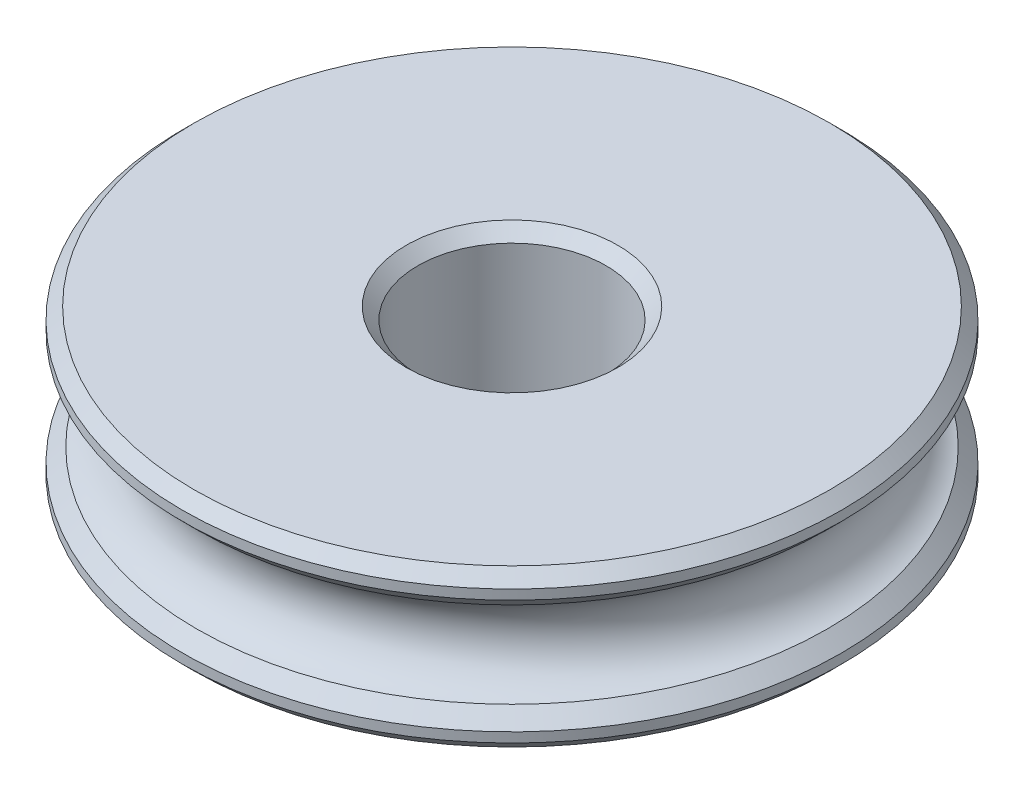
from build123d import *

# Parameters (mm, degrees)
SKETCH1_R           = 42
SKETCH1_R_2         = 12
BOSS_EXTRUDE1_DEPTH = 10
CHAMFER1_SIZE       = 1.5


with BuildPart() as part:
    # Sketch1 → Boss-Extrude1 (new, symmetric)
    with BuildSketch(Plane(origin=(0, 0, 0), x_dir=(1, 0, 0), z_dir=(0, 1, 0))):
        with Locations(Location((0, 0, 0), (0, 0, 270))):
            Circle(SKETCH1_R)
        with Locations(Location((0, 0, 0), (0, 0, 270))):
            Circle(SKETCH1_R_2, mode=Mode.SUBTRACT)
    extrude(amount=BOSS_EXTRUDE1_DEPTH, both=True)

    # Sketch6 → Cut-Revolve11 (revolve, cut)
    with BuildSketch(Plane.XY, mode=Mode.PRIVATE) as cut_revolve11_sk:
        with BuildLine():
            Line((-42, 5.764577254), (-42, -5.764577254))
            ThreePointArc((-42, -5.764577254), (-36.235422746, 0), (-42, 5.764577254))
        make_face()
    revolve(cut_revolve11_sk.sketch.rotate(Axis((0, 0, 0), (0, 1, 0)), 180), axis=Axis((0, 0, 0), (0, 1, 0)), mode=Mode.SUBTRACT)

    # Chamfer1
    # the kernel refuses this chamfer: 1.5 mm, written as the material it takes off along each edge
    with BuildSketch(Plane(origin=(0, -5.764577254, 0), x_dir=(0, 0, 1), z_dir=(-1, 0, 0))) as chamfer1_piece_1:
        with BuildLine():
            Line((42, -CHAMFER1_SIZE), (40.217482923, 0.282517077))
            ThreePointArc((40.217482923, 0.282517077), (41.073277318, 0.074978324), (42, 0))
            Line((42, 0), (42, -CHAMFER1_SIZE))
        make_face()
    revolve(axis=Axis((0, -5.764577254, 0), (0, 1, 0)), revolution_arc=90, mode=Mode.SUBTRACT)
    with BuildSketch(Plane(origin=(0, 5.764577254, 0), x_dir=(1, 0, 0), z_dir=(0, 0, 1))) as chamfer1_piece_2:
        with BuildLine():
            Line((40.217482923, -0.282517077), (42, CHAMFER1_SIZE))
            Line((42, CHAMFER1_SIZE), (42, 0))
            ThreePointArc((42, 0), (41.073277318, -0.074978324), (40.217482923, -0.282517077))
        make_face()
    revolve(axis=Axis((0, 5.764577254, 0), (0, 1, 0)), revolution_arc=270, mode=Mode.SUBTRACT)
    with BuildSketch(Plane(origin=(0, -10, 0), x_dir=(0, 0, 1), z_dir=(-1, 0, 0))) as chamfer1_piece_3:
        Polygon((42, CHAMFER1_SIZE), (42 - CHAMFER1_SIZE, 0), (42, 0), align=None)
    revolve(axis=Axis((0, -10, 0), (0, 1, 0)), mode=Mode.SUBTRACT)
    with BuildSketch(Plane(origin=(0, 10, 0), x_dir=(0, 0, 1), z_dir=(-1, 0, 0))) as chamfer1_piece_4:
        Polygon((42, -CHAMFER1_SIZE), (42 - CHAMFER1_SIZE, 0), (42, 0), align=None)
    revolve(axis=Axis((0, 10, 0), (0, 1, 0)), mode=Mode.SUBTRACT)
    with BuildSketch(Plane(origin=(0, -10, 0), x_dir=(0, 0, 1), z_dir=(-1, 0, 0))) as chamfer1_piece_5:
        Polygon((12 + CHAMFER1_SIZE, 0), (12, CHAMFER1_SIZE), (12, 0), align=None)
    revolve(axis=Axis((0, -10, 0), (0, 1, 0)), mode=Mode.SUBTRACT)
    with BuildSketch(Plane(origin=(0, 10, 0), x_dir=(0, 0, 1), z_dir=(-1, 0, 0))) as chamfer1_piece_6:
        Polygon((12, -CHAMFER1_SIZE), (12 + CHAMFER1_SIZE, 0), (12, 0), align=None)
    revolve(axis=Axis((0, 10, 0), (0, 1, 0)), mode=Mode.SUBTRACT)
    with BuildSketch(Plane(origin=(0, 5.764577254, 0), x_dir=(0, 0, 1), z_dir=(-1, 0, 0))) as chamfer1_piece_7:
        with BuildLine():
            Line((40.217482923, -0.282517077), (42, CHAMFER1_SIZE))
            Line((42, CHAMFER1_SIZE), (42, 0))
            ThreePointArc((42, 0), (41.073277318, -0.074978324), (40.217482923, -0.282517077))
        make_face()
    revolve(axis=Axis((0, 5.764577254, 0), (0, 1, 0)), revolution_arc=90, mode=Mode.SUBTRACT)
    with BuildSketch(Plane(origin=(0, -5.764577254, 0), x_dir=(1, 0, 0), z_dir=(0, 0, 1))) as chamfer1_piece_8:
        with BuildLine():
            Line((42, -CHAMFER1_SIZE), (40.217482923, 0.282517077))
            ThreePointArc((40.217482923, 0.282517077), (41.073277318, 0.074978324), (42, 0))
            Line((42, 0), (42, -CHAMFER1_SIZE))
        make_face()
    revolve(axis=Axis((0, -5.764577254, 0), (0, 1, 0)), revolution_arc=270, mode=Mode.SUBTRACT)


solid = part.part
